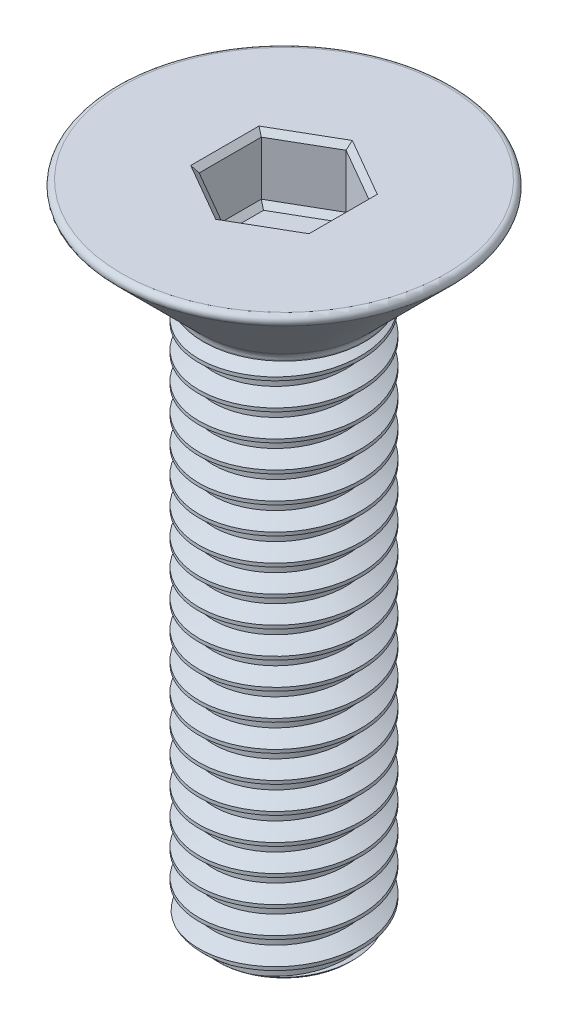
from build123d import *

# Parameters (mm, degrees)
SKETCH1_R           = 1.5
BOSS_EXTRUDE1_DEPTH = 10.14
THREAD1_PITCH       = 0.5
SKETCH5_R           = 1.5
BOSS_EXTRUDE2_DEPTH = 0.1
SKETCH6_R           = 1.5
BOSS_EXTRUDE3_DEPTH = 1.76
BOSS_EXTRUDE3_DRAFT = -45
FILLET1_R           = 0.1
FILLET2_R           = 0.2
CUT_EXTRUDE1_DEPTH  = 1.1
CHAMFER1_SIZE       = 0.1
CUT_EXTRUDE2_DEPTH  = 0.1
CUT_EXTRUDE2_DRAFT  = -45


with BuildPart() as part:
    # Sketch1 → Boss-Extrude1 (new body)
    with BuildSketch(Plane(origin=(0, 0, 0), x_dir=(1, 0, 0), z_dir=(0, 1, 0))):
        with Locations(Location((0, 0, 0), (0, 0, 270))):
            Circle(SKETCH1_R)
    extrude(amount=BOSS_EXTRUDE1_DEPTH)

    # Thread1: the profile of Thread Profile1 profile screwed along a right-hand helix of 22.28 turns, 6 arcs to a turn; built about Z, then put on its axis
    thread1_z = Axis((0, 0, 0), (0, 0, 1))
    thread1_corners = [(1.5003, 0, -0.000173205), (1.5003, 0, 0.437673204), (1.229367063, 0, 0.281249999), (1.229367063, 0, 0.156249999)]
    with BuildLine(mode=Mode.PRIVATE) as thread1_profile:
        Line(thread1_corners[0], thread1_corners[1])
        Line(thread1_corners[1], thread1_corners[2])
        Line(thread1_corners[2], thread1_corners[3])
        Line(thread1_corners[3], thread1_corners[0])
    thread1_cap = Face(thread1_profile.wire())
    thread1_turn_angles = [0, 30, 60, 90, 120, 150, 180, 210, 240, 270, 300, 330, 360]
    thread1_turn_weights = [1, 0.8660254037844387, 1, 0.8660254037844387, 1, 0.8660254037844387, 1, 0.8660254037844387, 1, 0.8660254037844387, 1, 0.8660254037844387, 1]
    thread1_turn_rails = [Edge.make_bspline([Vector(p[0], p[1], 0).rotate(thread1_z, thread1_turn_angles[k]) / thread1_turn_weights[k] + Vector(0, 0, p[2] + THREAD1_PITCH * thread1_turn_angles[k] / 360) for k in range(13)], [0, 0, 0, 1, 1, 2, 2, 3, 3, 4, 4, 5, 5, 6, 6, 6], 2, thread1_turn_weights) for p in thread1_corners]
    thread1_turn_sides = [Face.make_surface_from_curves(thread1_turn_rails[p[0]], thread1_turn_rails[p[1]]) for p in [(0, 1), (1, 2), (2, 3), (3, 0)]]
    thread1_last_angles = [7920, 7950, 7980, 8000.4, 8020.8]
    thread1_last_weights = [1, 0.8660254037844387, 1, 0.9372819894918909, 1]
    thread1_last_rails = [Edge.make_bspline([Vector(p[0], p[1], 0).rotate(thread1_z, thread1_last_angles[k]) / thread1_last_weights[k] + Vector(0, 0, p[2] + THREAD1_PITCH * thread1_last_angles[k] / 360) for k in range(5)], [0, 0, 0, 1, 1, 2, 2, 2], 2, thread1_last_weights) for p in thread1_corners]
    thread1_last_sides = [Face.make_surface_from_curves(thread1_last_rails[p[0]], thread1_last_rails[p[1]]) for p in [(0, 1), (1, 2), (2, 3), (3, 0)]]
    thread1 = Plane(origin=(0, 11.14, 0), x_dir=(-1, 0, 0), z_dir=(0, -1, 0)) * Solid(Shell([*[p.moved(Location((0, 0, THREAD1_PITCH * i))) for i in range(22) for p in thread1_turn_sides], *thread1_last_sides, thread1_cap, thread1_cap.rotate(thread1_z, 8020.8).moved(Location((0, 0, THREAD1_PITCH * 8020.8 / 360)))]))
    add(thread1, mode=Mode.SUBTRACT)

    # Sketch5 → Boss-Extrude2 (add)
    with BuildSketch(Plane(origin=(0, 10.14, 0), x_dir=(1, 0, 0), z_dir=(0, 1, 0))):
        with Locations(Location((0, 0, 0), (0, 0, 79.630240195))):
            Circle(SKETCH5_R)
    extrude(amount=BOSS_EXTRUDE2_DEPTH)


with BuildPart() as boss_extrude3_tool:
    # Sketch6 → Boss-Extrude3 (with draft: the straight prism first)
    with BuildSketch(Plane(origin=(0, 10.24, 0), x_dir=(1, 0, 0), z_dir=(0, 1, 0))):
        with Locations(Location((0, 0, 0), (0, 0, 79.630240195))):
            Circle(SKETCH6_R)
    extrude(amount=BOSS_EXTRUDE3_DEPTH)
    # Boss-Extrude3: the draft: its side faces are tilted about the plane it starts from
    boss_extrude3_sides = [boss_extrude3_tool.faces().sort_by_distance(p)[0] for p in [
        (-0.27, 11.12, 1.475499915),
    ]]
    draft(boss_extrude3_sides, Plane(origin=(0, 10.24, 0), x_dir=(1, 0, 0), z_dir=(0, 1, 0)), BOSS_EXTRUDE3_DRAFT)


with BuildPart() as part_1:
    add(part.part)

    # Boss-Extrude3: add boss_extrude3_tool
    add(boss_extrude3_tool.part)

    # Sketch7 → Cut-Revolve1 (revolve, cut)
    with BuildSketch(Plane.XY, mode=Mode.PRIVATE) as cut_revolve1_sk:
        Polygon((1.51, 0), (1.51, 0.3), (1.21, 0), align=None)
    revolve(cut_revolve1_sk.sketch.rotate(Axis((0, 0, 0), (0, 1, 0)), 135.522486844), axis=Axis((0, 0, 0), (0, 1, 0)), mode=Mode.SUBTRACT)

    # Fillet1
    fillet1_edges = [part_1.edges().sort_by_distance(p)[0] for p in [
        (-0.5868, 12, 3.206753149),
    ]]
    fillet(fillet1_edges, radius=FILLET1_R)

    # Fillet2
    fillet2_edges = [part_1.edges().sort_by_distance(p)[0] for p in [
        (-0.27, 10.24, 1.475499915),
    ]]
    fillet(fillet2_edges, radius=FILLET2_R)

    # Sketch8 → Cut-Extrude1 (cut)
    with BuildSketch(Plane(origin=(0, 12, 0), x_dir=(1, 0, 0), z_dir=(0, 1, 0))):
        Polygon((0, 1.154700538), (-1, 0.577350269), (-1, -0.577350269), (0, -1.154700538), (1, -0.577350269), (1, 0.577350269), align=None)
    extrude(amount=-CUT_EXTRUDE1_DEPTH, mode=Mode.SUBTRACT)

    # Chamfer1
    chamfer1_edges = [part_1.edges().sort_by_distance(p)[0] for p in [
        (0.5, 12, -0.866025404),
        (-0.5, 12, -0.866025404),
        (-1, 12, 0),
        (-0.5, 12, 0.866025404),
        (0.5, 12, 0.866025404),
        (1, 12, 0),
    ]]
    chamfer(chamfer1_edges, length=CHAMFER1_SIZE)


with BuildPart() as cut_extrude2_tool:
    # Sketch9 → Cut-Extrude2 (with draft: the straight prism first)
    with BuildSketch(Plane(origin=(0, 10.9, 0), x_dir=(1, 0, 0), z_dir=(0, 1, 0))):
        Polygon((0, 1.154700538), (-1, 0.577350269), (-1, -0.577350269), (0, -1.154700538), (1, -0.577350269), (1, 0.577350269), align=None)
    extrude(amount=-CUT_EXTRUDE2_DEPTH)
    # Cut-Extrude2: the draft: its side faces are tilted about the plane it starts from
    cut_extrude2_sides = [cut_extrude2_tool.faces().sort_by_distance(p)[0] for p in [
        (-0.5, 10.85, -0.866025404),
        (-1, 10.85, 0),
        (-0.5, 10.85, 0.866025404),
        (0.5, 10.85, 0.866025404),
        (1, 10.85, 0),
        (0.5, 10.85, -0.866025404),
    ]]
    draft(cut_extrude2_sides, Plane(origin=(0, 10.9, 0), x_dir=(1, 0, 0), z_dir=(0, 1, 0)), CUT_EXTRUDE2_DRAFT)


with BuildPart() as part_2:
    add(part_1.part)

    # Cut-Extrude2: cut by cut_extrude2_tool
    add(cut_extrude2_tool.part, mode=Mode.SUBTRACT)


solid = part_2.part
